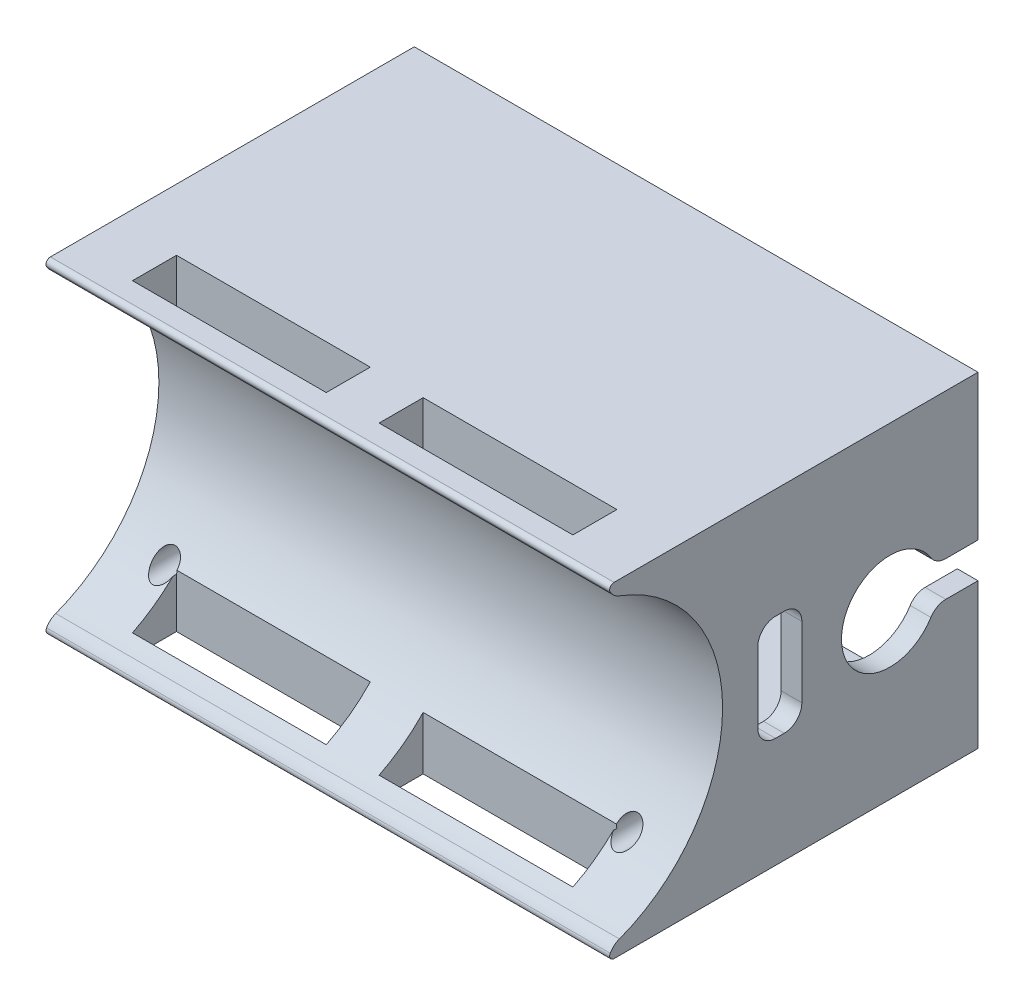
from build123d import *

# Parameters (mm, degrees)
SKETCH_1_W                 = 64
SKETCH_1_H                 = 37
EXTRUDE_1_DEPTH            = 42
SHELL_1_T                  = -2.35
SHELL_1_THICKNESS_2_FACE_W = 59.3
SHELL_1_THICKNESS_2_FACE_H = 32.3
SHELL_1_THICKNESS_2_DEPTH  = 12.65
F_3_0MM_START              = 27
F_3_0MM_1_OUTLINE_R        = 1.3
F_3_0MM_1_DEPTH            = 15
SKETCH_4_R                 = 18
CUT_EXTRUDE_1_DEPTH        = 79.754364958
SKETCH_5_W                 = 22
SKETCH_5_H                 = 5
CUT_EXTRUDE_2_DEPTH        = 65.474801394
SKETCH_6_R                 = 5.5
SKETCH_6_W                 = 5
SKETCH_6_H                 = 12
CUT_EXTRUDE_3_DEPTH        = 10
CUT_EXTRUDE_1_2_DEPTH      = 79.754365093
CUT_EXTRUDE_1_2_DEPTH_BACK = 10
SKETCH_7_W                 = 5
SKETCH_7_H                 = 4
FILLET_1_R                 = 2
FILLET_2_R                 = 2
FILLET_3_R                 = 0.5


# Read off the part's stored shape, not the designer's step: Ø3.0mm 暗销孔1
with BuildPart() as part:
    # 草图1 → 凸台-拉伸1 (new body)
    with BuildSketch(Plane.XY):
        Rectangle(SKETCH_1_W, SKETCH_1_H)
    extrude(amount=EXTRUDE_1_DEPTH)

    # 抽壳1
    shell_1_openings = [part.faces().sort_by_distance(p)[0] for p in [
        (0, 0, 0),
    ]]
    offset(amount=SHELL_1_T, openings=shell_1_openings, kind=Kind.INTERSECTION)

    # 抽壳1 thickness 2 face (on inner face of the shell) → 抽壳1 thickness 2 (add)
    with BuildSketch(Plane.XY.offset(39.65)):
        Rectangle(SHELL_1_THICKNESS_2_FACE_W, SHELL_1_THICKNESS_2_FACE_H)
    extrude(amount=-SHELL_1_THICKNESS_2_DEPTH)

    # Ø3.0mm 暗销孔1 outline → Ø3.0mm 暗销孔1 (cut)
    with BuildSketch(Plane.XY.offset(F_3_0MM_START)):
        with Locations((26.25, -12.5)):
            Circle(F_3_0MM_1_OUTLINE_R)
        with Locations((-26.25, 12.5)):
            Circle(F_3_0MM_1_OUTLINE_R)
        with Locations((-26.25, -12.5)):
            Circle(F_3_0MM_1_OUTLINE_R)
        with Locations((26.25, 12.5)):
            Circle(F_3_0MM_1_OUTLINE_R)
    extrude(amount=F_3_0MM_1_DEPTH, mode=Mode.SUBTRACT)

    # 草图4 → Cut-Extrude 1 (cut, through all)
    with BuildSketch(Plane(origin=(32, 0, 0), x_dir=(0, 0, -1), z_dir=(1, 0, 0))):
        with Locations((-47, 0)):
            Circle(SKETCH_4_R)
    extrude(amount=-CUT_EXTRUDE_1_DEPTH, mode=Mode.SUBTRACT)

    # 草图5 → 切除-拉伸2 (cut, through all)
    with BuildSketch(Plane.XZ.offset(18.5)):
        with Locations((14, 36.5)):
            Rectangle(SKETCH_5_W, SKETCH_5_H)
        with Locations((-14, 36.5)):
            Rectangle(SKETCH_5_W, SKETCH_5_H)
    extrude(amount=-CUT_EXTRUDE_2_DEPTH, mode=Mode.SUBTRACT)

    # 草图6 → 切除-拉伸3 (cut)
    with BuildSketch(Plane(origin=(32, 0, 0), x_dir=(0, 0, -1), z_dir=(1, 0, 0))):
        with Locations(Location((-10, 0, 0), (0, 0, 90))):
            Circle(SKETCH_6_R)
        with Locations((-22.5, 0)):
            Rectangle(SKETCH_6_W, SKETCH_6_H)
    extrude(amount=-CUT_EXTRUDE_3_DEPTH, mode=Mode.SUBTRACT)

    # 草图7 → Cut-Extrude 1 2 (cut, two sides: drawn at the far end of the back side and taken through both)
    with BuildSketch(Plane(origin=(32, 0, 0), x_dir=(0, 0, -1), z_dir=(1, 0, 0)).offset(-CUT_EXTRUDE_1_2_DEPTH_BACK)):
        with Locations((-2.5, 0)):
            Rectangle(SKETCH_7_W, SKETCH_7_H)
    extrude(amount=CUT_EXTRUDE_1_2_DEPTH + CUT_EXTRUDE_1_2_DEPTH_BACK, mode=Mode.SUBTRACT)

    # 圆角1
    fillet_1_edges = [part.edges().sort_by_distance(p)[0] for p in [
        (30.825, -6, 25),
        (30.825, 6, 25),
        (30.825, 6, 20),
        (30.825, -6, 20),
        (30.825, -2, 4.876524617),
        (30.825, 2, 4.876524617),
    ]]
    fillet(fillet_1_edges, radius=FILLET_1_R)

    # 圆角2
    # the kernel refuses this fillet: 2 mm, written as the material it takes off along each edge
    with BuildSketch(Plane(origin=(-35.388469359, -17.291616466, 42), x_dir=(0, -1.0, -4.0690356929386436e-12), z_dir=(1, 0, 0))) as fillet_2_piece_1:
        with BuildLine():
            CenterArc((1.448789292, 1.985498696), FILLET_2_R, 200.442973307, 62.653215254)
            Line((-0.425251284, 1.286948826), (-0.462732095, 1.272977829))
            ThreePointArc((-0.462732095, 1.272977829), (-0.238488291, 0.634928522), (-0.038425814, -0.011111111))
            Line((-0.038425814, -0.011111111), (0, -0.04))
            ThreePointArc((0, -0.04), (0.604191767, -0.04), (1.203575419, -0.039709974))
            Line((1.203575419, -0.039709974), (1.208383534, 0))
        make_face()
    extrude(amount=70.776938719, mode=Mode.SUBTRACT)
    with BuildSketch(Plane(origin=(-35.388469359, 17.291616466, 42), x_dir=(0, -0.31374880411831046, -0.9495060231058727), z_dir=(1, 0, 0))) as fillet_2_piece_2:
        with BuildLine():
            CenterArc((1.430687063, 1.998582), FILLET_2_R, 205.189108199, 62.653215254)
            Line((-0.379128889, 1.147367444), (-0.415325208, 1.130343153))
            ThreePointArc((-0.415325208, 1.130343153), (-0.227544685, 0.56113377), (-0.037980241, -0.012549952))
            Line((-0.037980241, -0.012549952), (0.001505986, -0.03997164))
            ThreePointArc((0.001505986, -0.03997164), (0.677693872, -0.027238004), (1.353881757, -0.03997164))
            Line((1.353881757, -0.03997164), (1.355387744, 0))
        make_face()
    extrude(amount=70.776938719, mode=Mode.SUBTRACT)

    # 圆角3
    fillet_3_edges = [part.edges().sort_by_distance(p)[0] for p in [
        (0, -18.5, 42),
        (0, 18.5, 42),
    ]]
    fillet(fillet_3_edges, radius=FILLET_3_R)


solid = part.part
